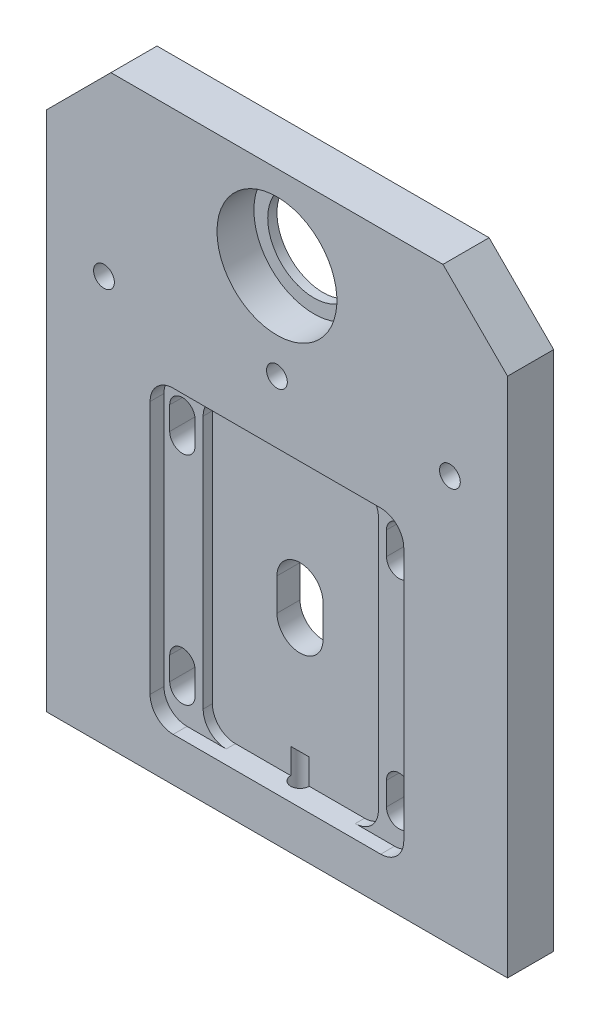
from build123d import *

# Parameters (mm, degrees)
ESTRUSIONE_ESTRUSIONE1_DEPTH = 10
SCHIZZO2_R                   = 10
TAGLIO_ESTRUSIONE1_DEPTH     = 10
SCHIZZO3_R                   = 2.25
TAGLIO_ESTRUSIONE2_DEPTH     = 10
TAGLIO_ESTRUSIONE3_DEPTH     = 3
TAGLIO_ESTRUSIONE4_DEPTH     = 2
TAGLIO_ESTRUSIONE5_DEPTH     = 162.721983663
TAGLIO_ESTRUSIONE6_DEPTH     = 162.796168063
SCHIZZO8_R                   = 13
TAGLIO_ESTRUSIONE7_DEPTH     = 8
SCHIZZO9_R                   = 4
TAGLIO_ESTRUSIONE8_DEPTH     = 4
SCHIZZO10_R                  = 2
TAGLIO_ESTRUSIONE9_DEPTH     = 15


with BuildPart() as part:
    # Schizzo1 → Estrusione-Estrusione1 (new body)
    with BuildSketch(Plane.XY):
        Polygon((0, 113), (14, 127), (86, 127), (100, 113), (100, 0), (0, 0), align=None)
    extrude(amount=-ESTRUSIONE_ESTRUSIONE1_DEPTH)

    # Schizzo2 → Taglio-Estrusione1 (cut)
    with BuildSketch(Plane.XY):
        with Locations((50, 108.7)):
            Circle(SCHIZZO2_R)
    extrude(amount=-TAGLIO_ESTRUSIONE1_DEPTH, mode=Mode.SUBTRACT)

    # Schizzo3 → Taglio-Estrusione2 (cut)
    with BuildSketch(Plane.XY):
        with Locations((12.5, 88)):
            Circle(SCHIZZO3_R)
        with Locations((50, 88)):
            Circle(SCHIZZO3_R)
        with Locations((87.5, 88)):
            Circle(SCHIZZO3_R)
    extrude(amount=-TAGLIO_ESTRUSIONE2_DEPTH, mode=Mode.SUBTRACT)

    # Schizzo4 → Taglio-Estrusione3 (cut)
    with BuildSketch(Plane.XY):
        with BuildLine():
            Line((27.5, 74.5), (72.5, 74.5))
            ThreePointArc((72.5, 74.5), (76.035533906, 73.035533906), (77.5, 69.5))
            Line((77.5, 69.5), (77.5, 14.5))
            ThreePointArc((77.5, 14.5), (76.035533906, 10.964466094), (72.5, 9.5))
            Line((72.5, 9.5), (27.5, 9.5))
            ThreePointArc((27.5, 9.5), (23.964466094, 10.964466094), (22.5, 14.5))
            Line((22.5, 14.5), (22.5, 69.5))
            ThreePointArc((22.5, 69.5), (23.964466094, 73.035533906), (27.5, 74.5))
        make_face()
    extrude(amount=-TAGLIO_ESTRUSIONE3_DEPTH, mode=Mode.SUBTRACT)

    # Schizzo5 → Taglio-Estrusione4 (cut)
    with BuildSketch(Plane.XY.offset(-3)):
        with BuildLine():
            Line((36, 74.5), (64, 74.5))
            ThreePointArc((64, 74.5), (67.535533906, 73.035533906), (69, 69.5))
            Line((69, 69.5), (69, 14.5))
            ThreePointArc((69, 14.5), (67.535533906, 10.964466094), (64, 9.5))
            Line((64, 9.5), (36, 9.5))
            ThreePointArc((36, 9.5), (32.464466094, 10.964466094), (31, 14.5))
            Line((31, 14.5), (31, 69.5))
            ThreePointArc((31, 69.5), (32.464466094, 73.035533906), (36, 74.5))
        make_face()
    extrude(amount=-TAGLIO_ESTRUSIONE4_DEPTH, mode=Mode.SUBTRACT)

    # Schizzo6 → Taglio-Estrusione5 (cut, through all)
    with BuildSketch(Plane.XY.offset(-5)):
        with BuildLine():
            Line((54.993239352, 45.5), (54.993239352, 38.5))
            ThreePointArc((54.993239352, 38.5), (50, 33.506760648), (45.006760648, 38.5))
            Line((45.006760648, 38.5), (45.006760648, 45.5))
            ThreePointArc((45.006760648, 45.5), (50, 50.493239352), (54.993239352, 45.5))
        make_face()
    extrude(amount=-TAGLIO_ESTRUSIONE5_DEPTH, mode=Mode.SUBTRACT)

    # Schizzo7 → Taglio-Estrusione6 (cut, through all)
    with BuildSketch(Plane.XY.offset(-3)):
        with BuildLine():
            Line((23.75, 63), (23.75, 68))
            ThreePointArc((23.75, 68), (26.5, 70.75), (29.25, 68))
            Line((29.25, 68), (29.25, 63))
            ThreePointArc((29.25, 63), (26.5, 60.25), (23.75, 63))
        make_face()
        with BuildLine():
            Line((70.75, 63), (70.75, 68))
            ThreePointArc((70.75, 68), (73.5, 70.75), (76.25, 68))
            Line((76.25, 68), (76.25, 63))
            ThreePointArc((76.25, 63), (73.5, 60.25), (70.75, 63))
        make_face()
        with BuildLine():
            Line((23.75, 16), (23.75, 21))
            ThreePointArc((23.75, 21), (26.5, 23.75), (29.25, 21))
            Line((29.25, 21), (29.25, 16))
            ThreePointArc((29.25, 16), (26.5, 13.25), (23.75, 16))
        make_face()
        with BuildLine():
            Line((70.75, 16), (70.75, 21))
            ThreePointArc((70.75, 21), (73.5, 23.75), (76.25, 21))
            Line((76.25, 21), (76.25, 16))
            ThreePointArc((76.25, 16), (73.5, 13.25), (70.75, 16))
        make_face()
    extrude(amount=-TAGLIO_ESTRUSIONE6_DEPTH, mode=Mode.SUBTRACT)

    # Schizzo8 → Taglio-Estrusione7 (cut)
    with BuildSketch(Plane(origin=(0, 0, 0), x_dir=(-1, 0, 0), z_dir=(0, 0, -1))):
        with Locations((-50, 108.7)):
            Circle(SCHIZZO8_R)
    extrude(amount=TAGLIO_ESTRUSIONE7_DEPTH, mode=Mode.SUBTRACT)

    # Schizzo9 → Taglio-Estrusione8 (cut)
    with BuildSketch(Plane(origin=(0, 0, -10), x_dir=(-1, 0, 0), z_dir=(0, 0, -1))):
        with Locations((-85, 83)):
            Circle(SCHIZZO9_R)
        with Locations((-50, 88)):
            Circle(SCHIZZO9_R)
        with Locations((-12.5, 88)):
            Circle(SCHIZZO9_R)
    extrude(amount=-TAGLIO_ESTRUSIONE8_DEPTH, mode=Mode.SUBTRACT)

    # Schizzo10 → Taglio-Estrusione9 (cut)
    with BuildSketch(Plane.XZ):
        with Locations((50, -5)):
            Circle(SCHIZZO10_R)
        with Locations((19.5, -5)):
            Circle(SCHIZZO10_R)
        with Locations((80.5, -5)):
            Circle(SCHIZZO10_R)
    extrude(amount=-TAGLIO_ESTRUSIONE9_DEPTH, mode=Mode.SUBTRACT)


solid = part.part
